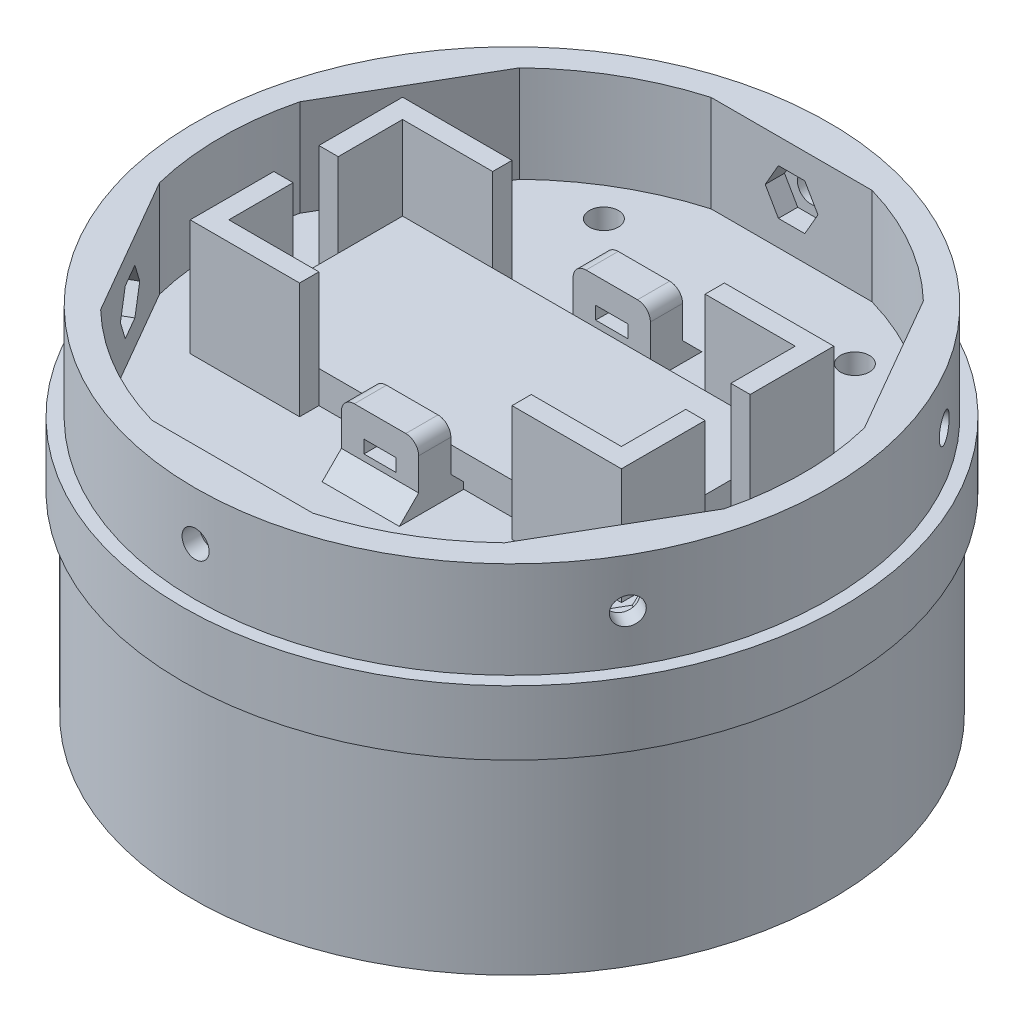
from build123d import *

# Parameters (mm, degrees)
SKETCH_5_R               = 49.2
EXTRUDE_3_DEPTH          = 15
SKETCH_9_R               = 2.25
CUT_EXTRUDE_3_DEPTH      = 56
EXTRUDE_4_DEPTH          = 18
SKETCH_4_W               = 61
SKETCH_4_H               = 27
EXTRUDE_5_DEPTH          = 5
SKETCH_11_W              = 12
SKETCH_11_H              = 5
EXTRUDE_6_DEPTH          = 10
FILLET_1_R               = 2
SKETCH_12_W              = 5
SKETCH_12_H              = 2
CUT_EXTRUDE_4_DEPTH      = 6
FILLET_1_OF_MIRROR_3_R   = 2
CHAMFER_5_SIZE           = 3
CUT_EXTRUDE_6_DEPTH      = 3
SKETCH_8_R               = 2.1
CUT_EXTRUDE_7_DEPTH      = 36
PATTERN_CIRCULAR_5_COUNT = 6
PATTERN_CIRCULAR_6_COUNT = 6
SKETCH_13_R              = 44.709478945
EXTRUDE_7_DEPTH          = 0.4
CHAMFER_6_SIZE           = 3


with BuildPart() as part:
    # Эскиз1 → Повернуть1 (revolve)
    with BuildSketch(Plane.XY, mode=Mode.PRIVATE) as revolve_1_sk:
        Polygon((44.9, 0), (49.7, 0), (49.7, 30), (51.2, 30), (51.2, 40), (0, 40), (0, 35), (44.9, 35), (44.9, 15), (32.9, 15), (32.9, 10), (44.9, 10), (44.9, 5), align=None)
    revolve(revolve_1_sk.sketch.rotate(Axis((0, 0, 0), (0, 1, 0)), 90), axis=Axis((0, 0, 0), (0, 1, 0)))

    # Эскиз5 → Бобышка-Вытянуть3 (add)
    with BuildSketch(Plane(origin=(0, 40, 0), x_dir=(1, 0, 0), z_dir=(0, 1, 0))):
        with Locations(Location((0, 0, 0), (0, 0, 270))):
            Circle(SKETCH_5_R)
        with BuildLine():
            ThreePointArc((-31.367715242, -32.543915568), (-22.6, -39.144348251), (-12.5, -43.437196042))
            Line((-12.5, -43.437196042), (12.5, -43.437196042))
            ThreePointArc((12.5, -43.437196042), (22.6, -39.144348251), (31.367715242, -32.543915568))
            Line((31.367715242, -32.543915568), (43.867715242, -10.893280474))
            ThreePointArc((43.867715242, -10.893280474), (45.2, 0), (43.867715242, 10.893280474))
            Line((43.867715242, 10.893280474), (31.367715242, 32.543915568))
            ThreePointArc((31.367715242, 32.543915568), (22.6, 39.144348251), (12.5, 43.437196042))
            Line((12.5, 43.437196042), (-12.5, 43.437196042))
            ThreePointArc((-12.5, 43.437196042), (-22.6, 39.144348251), (-31.367715242, 32.543915568))
            Line((-31.367715242, 32.543915568), (-43.867715242, 10.893280474))
            ThreePointArc((-43.867715242, 10.893280474), (-45.2, 0), (-43.867715242, -10.893280474))
            Line((-43.867715242, -10.893280474), (-31.367715242, -32.543915568))
        make_face(mode=Mode.SUBTRACT)
    extrude(amount=EXTRUDE_3_DEPTH)

    # Эскиз9 → Вырез-Вытянуть3 (cut)
    with BuildSketch(Plane.XZ):
        with Locations(Location((39, 0, 0), (0, 0, 270))):
            Circle(SKETCH_9_R)
    cut_extrude_3 = extrude(amount=-CUT_EXTRUDE_3_DEPTH, mode=Mode.SUBTRACT)

    # Эскиз10 → Бобышка-Вытянуть4 (add)
    with BuildSketch(Plane(origin=(0, 40, 0), x_dir=(1, 0, 0), z_dir=(0, 1, 0))):
        Polygon((30.5, -13.5), (30.5, -3.5), (33.5, -3.5), (33.5, -16.5), (16.5, -16.5), (16.5, -13.5), align=None)
        Polygon((-30.5, -13.5), (-16.5, -13.5), (-16.5, -16.5), (-33.5, -16.5), (-33.5, -3.5), (-30.5, -3.5), align=None)
        Polygon((-30.5, 13.5), (-16.5, 13.5), (-16.5, 16.5), (-33.5, 16.5), (-33.5, 3.5), (-30.5, 3.5), align=None)
        Polygon((16.5, 16.5), (16.5, 13.5), (30.5, 13.5), (30.5, 3.5), (33.5, 3.5), (33.5, 16.5), align=None)
    extrude(amount=EXTRUDE_4_DEPTH)

    # Эскиз4 → Бобышка-Вытянуть5 (add)
    with BuildSketch(Plane(origin=(0, 40, 0), x_dir=(1, 0, 0), z_dir=(0, 1, 0))):
        Rectangle(SKETCH_4_W, SKETCH_4_H)
    extrude(amount=EXTRUDE_5_DEPTH)

    # Эскиз11 → Бобышка-Вытянуть6 (add)
    with BuildSketch(Plane(origin=(0, 40, 0), x_dir=(1, 0, 0), z_dir=(0, 1, 0))):
        with Locations((0, 18)):
            Rectangle(SKETCH_11_W, SKETCH_11_H)
    extrude_6 = extrude(amount=EXTRUDE_6_DEPTH)

    # Скругление1
    fillet_1_edges = [part.edges().sort_by_distance(p)[0] for p in [
        (6, 50, -18),
        (-6, 50, -18),
    ]]
    fillet(fillet_1_edges, radius=FILLET_1_R)

    # Эскиз12 → Вырез-Вытянуть4 (cut)
    with BuildSketch(Plane(origin=(0, 0, -20.5), x_dir=(-1, 0, 0), z_dir=(0, 0, -1))):
        with Locations((0, 45)):
            Rectangle(SKETCH_12_W, SKETCH_12_H)
    cut_extrude_4 = extrude(amount=-CUT_EXTRUDE_4_DEPTH, mode=Mode.SUBTRACT)

    # Зеркальное отражение3: Бобышка-Вытянуть6, Вырез-Вытянуть4 across plane
    add(extrude_6.mirror(Plane.XY))
    add(cut_extrude_4.mirror(Plane.XY), mode=Mode.SUBTRACT)

    # Скругление1 of Зеркальное отражение3
    fillet_1_of_mirror_3_edges = [part.edges().sort_by_distance(p)[0] for p in [
        (6, 50, 18),
        (-6, 50, 18),
    ]]
    fillet(fillet_1_of_mirror_3_edges, radius=FILLET_1_OF_MIRROR_3_R)

    # Фаска5
    # the kernel refuses this chamfer: 3 mm, written as the material it adds along each edge
    with BuildSketch(Plane(origin=(-6, 40, -20.5), x_dir=(0, -0.027495876610584467, -0.9996219169112969), z_dir=(1, 0, 0)), Plane(origin=(6, 40, -15.5), x_dir=(0, -0.027495876610584485, 0.9996219169112969), z_dir=(-1, 0, 0)), Plane(origin=(-6, 40, 20.5), x_dir=(0, 0.9996219169112965, -0.02749587661058676), z_dir=(1, 0, 0))) as chamfer_5_piece_1:
        Polygon((CHAMFER_5_SIZE * 0.999621916911, CHAMFER_5_SIZE * 0.0274958766106), (-CHAMFER_5_SIZE * 0.0274958766106, CHAMFER_5_SIZE * 0.999621916911), (0, 0), align=None)
    extrude(amount=12)
    with BuildSketch(Plane(origin=(6, 40, 15.5), x_dir=(0, -0.027495876610584485, -0.9996219169112969), z_dir=(-1, 0, 0))) as chamfer_5_piece_2:
        Polygon((CHAMFER_5_SIZE * 0.999621916911, -CHAMFER_5_SIZE * 0.0274958766106), (-CHAMFER_5_SIZE * 0.0274958766106, -CHAMFER_5_SIZE * 0.999621916911), (0, 0), align=None)
    extrude(amount=12)

    # Эскиз6 → Вырез-Вытянуть6 (cut)
    with BuildSketch(Plane(origin=(-37.617715242, 0, -21.718598021), x_dir=(0.4999999999999999, 0, -0.8660254037844386), z_dir=(0.8660254037844387, 0, 0.49999999999999994))):
        Polygon((4.099186911, 47.5), (2.049593456, 51.05), (-2.049593456, 51.05), (-4.099186911, 47.5), (-2.049593456, 43.95), (2.049593456, 43.95), align=None)
    cut_extrude_6 = extrude(amount=-CUT_EXTRUDE_6_DEPTH, mode=Mode.SUBTRACT)

    # Эскиз8 → Вырез-Вытянуть7 (cut)
    with BuildSketch(Plane(origin=(-37.617715242, 0, -21.718598021), x_dir=(0.4999999999999999, 0, -0.8660254037844386), z_dir=(0.8660254037844387, 0, 0.49999999999999994))):
        with Locations((0, 47.5)):
            Circle(SKETCH_8_R)
    cut_extrude_7 = extrude(amount=-CUT_EXTRUDE_7_DEPTH, mode=Mode.SUBTRACT)

    # Круговой массив5: Вырез-Вытянуть6, Вырез-Вытянуть7 ×6 about axis
    pattern_circular_5_axis = Axis((0, 0, 0), (0, 1, 0))
    add([cut_extrude_6.rotate(pattern_circular_5_axis, i * 360 / PATTERN_CIRCULAR_5_COUNT) for i in range(1, PATTERN_CIRCULAR_5_COUNT)], mode=Mode.SUBTRACT)
    add([cut_extrude_7.rotate(pattern_circular_5_axis, i * 360 / PATTERN_CIRCULAR_5_COUNT) for i in range(1, PATTERN_CIRCULAR_5_COUNT)], mode=Mode.SUBTRACT)

    # Круговой массив6: Вырез-Вытянуть3 ×6 about axis
    pattern_circular_6_axis = Axis((0, 0, 0), (0, 1, 0))
    for i in range(1, PATTERN_CIRCULAR_6_COUNT):
        add(cut_extrude_3.rotate(pattern_circular_6_axis, i * 360 / PATTERN_CIRCULAR_6_COUNT), mode=Mode.SUBTRACT)

    # Эскиз13 → Бобышка-Вытянуть7 (add)
    with BuildSketch(Plane.XZ.offset(-35)):
        Circle(SKETCH_13_R)
    extrude(amount=-EXTRUDE_7_DEPTH)

    # Фаска6
    chamfer_6_edges = [part.edges().sort_by_distance(p)[0] for p in [
        (0, 35, 44.9),
    ]]
    chamfer(chamfer_6_edges, length=CHAMFER_6_SIZE)


solid = part.part
